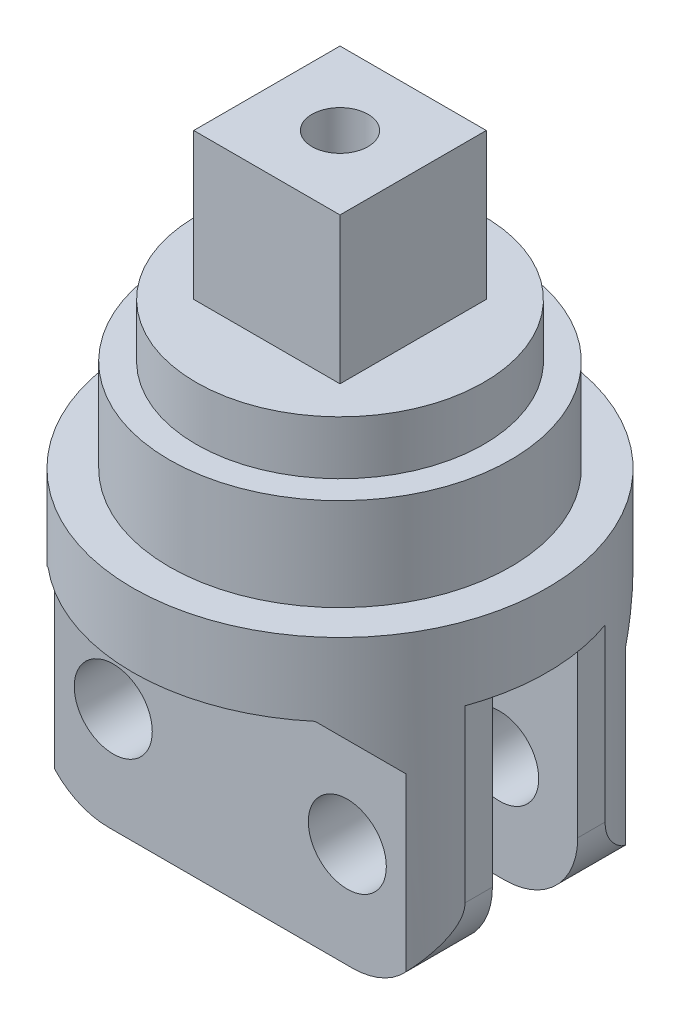
from build123d import *
from build123d.topology import SkipClean

# Parameters (mm, degrees)
SKETCH_9_R          = 9
EXTRUDE_4_DEPTH     = 3
SKETCH_10_R         = 7
EXTRUDE_5_DEPTH     = 6
SKETCH_11_W         = 16
SKETCH_11_H         = 3
EXTRUDE_6_DEPTH     = 10
SKETCH_12_R         = 1.6
CUT_EXTRUDE_3_DEPTH = 20.059118553
SKETCH_13_R         = 12.035495365
SKETCH_13_R_2       = 9
CUT_EXTRUDE_4_DEPTH = 30
FILLET_1_R          = 3
SKETCH_14_R         = 1.15
CUT_EXTRUDE_5_DEPTH = 30
SKETCH_15_W         = 22.433214128
SKETCH_15_H         = 3.5
CUT_EXTRUDE_6_DEPTH = 20
SKETCH_17_R         = 12.049205959
SKETCH_17_R_2       = 8.5
CUT_EXTRUDE_7_DEPTH = 20
SKETCH_18_R         = 9.534410067
SKETCH_18_R_2       = 5.9
CUT_EXTRUDE_8_DEPTH = 2.2
SKETCH_20_W         = 6
SKETCH_20_H         = 6
SKETCH_20_R         = 1.15
EXTRUDE_7_DEPTH     = 6
CHAMFER_1_SIZE      = 2


with BuildPart() as part:
    # Эскиз9 → Бобышка-Вытянуть4 (new body)
    with BuildSketch(Plane(origin=(0, 0, 0), x_dir=(1, 0, 0), z_dir=(0, 1, 0))):
        with Locations(Location((0, 0, 0), (0, 0, 270))):
            Circle(SKETCH_9_R)
    extrude(amount=EXTRUDE_4_DEPTH)

    # Эскиз10 → Бобышка-Вытянуть5 (add)
    with BuildSketch(Plane(origin=(0, 3, 0), x_dir=(1, 0, 0), z_dir=(0, 1, 0))):
        with Locations(Location((0, 0, 0), (0, 0, 270))):
            Circle(SKETCH_10_R)
    extrude(amount=EXTRUDE_5_DEPTH)

    # Эскиз11 → Бобышка-Вытянуть6 (add)
    with BuildSketch(Plane.XZ):
        with Locations((0, -3)):
            Rectangle(SKETCH_11_W, SKETCH_11_H)
        with Locations((0, 3)):
            Rectangle(SKETCH_11_W, SKETCH_11_H)
    extrude(amount=EXTRUDE_6_DEPTH)

    # Эскиз12 → Вырез-Вытянуть3 (cut, through all)
    with BuildSketch(Plane.XY.offset(4.5)):
        with Locations((-4.8, -5.7)):
            Circle(SKETCH_12_R)
        with Locations((4.8, -5.7)):
            Circle(SKETCH_12_R)
    extrude(amount=-CUT_EXTRUDE_3_DEPTH, mode=Mode.SUBTRACT)

    # Эскиз13 → Вырез-Вытянуть4 (cut)
    with SkipClean():  # the faces are left unmerged after this step: merging them gives an invalid solid
        with BuildSketch(Plane.XZ.offset(10)):
            Circle(SKETCH_13_R)
            with Locations(Location((0, 0, 0), (0, 0, 210))):
                Circle(SKETCH_13_R_2, mode=Mode.SUBTRACT)
        extrude(amount=-CUT_EXTRUDE_4_DEPTH, mode=Mode.SUBTRACT)
    add(part.part.scale(1), mode=Mode.REPLACE)  # the faces are merged on a copy

    # Скругление1
    fillet_1_edges = [part.edges().sort_by_distance(p)[0] for p in [
        (-8, -10, -2.811552813),
        (8, -10, -2.811552813),
        (8, -10, 2.811552813),
        (-8, -10, 2.811552813),
    ]]
    fillet(fillet_1_edges, radius=FILLET_1_R)

    # Эскиз14 → Вырез-Вытянуть5 (cut)
    with BuildSketch(Plane.XZ):
        with Locations(Location((0, 0, 0), (0, 0, 270))):
            Circle(SKETCH_14_R)
    extrude(amount=-CUT_EXTRUDE_5_DEPTH, mode=Mode.SUBTRACT)

    # Эскиз15 → Вырез-Вытянуть6 (cut)
    with BuildSketch(Plane.XZ):
        Rectangle(SKETCH_15_W, SKETCH_15_H)
    extrude(amount=CUT_EXTRUDE_6_DEPTH, mode=Mode.SUBTRACT)

    # Эскиз17 → Вырез-Вытянуть7 (cut)
    with BuildSketch(Plane.XZ.offset(10)):
        Circle(SKETCH_17_R)
        with Locations(Location((0, 0, 0), (0, 0, 328.034281249))):
            Circle(SKETCH_17_R_2, mode=Mode.SUBTRACT)
    extrude(amount=-CUT_EXTRUDE_7_DEPTH, mode=Mode.SUBTRACT)

    # Эскиз18 → Вырез-Вытянуть8 (cut)
    with BuildSketch(Plane(origin=(0, 9, 0), x_dir=(1, 0, 0), z_dir=(0, 1, 0))):
        Circle(SKETCH_18_R)
        with Locations(Location((0, 0, 0), (0, 0, 270))):
            Circle(SKETCH_18_R_2, mode=Mode.SUBTRACT)
    extrude(amount=-CUT_EXTRUDE_8_DEPTH, mode=Mode.SUBTRACT)

    # Эскиз20 → Бобышка-Вытянуть7 (add)
    with SkipClean():  # the faces are left unmerged after this step: merging them gives an invalid solid
        with BuildSketch(Plane(origin=(0, 9, 0), x_dir=(1, 0, 0), z_dir=(0, 1, 0))):
            Rectangle(SKETCH_20_W, SKETCH_20_H)
            with Locations(Location((0, 0, 0), (0, 0, 90))):
                Circle(SKETCH_20_R, mode=Mode.SUBTRACT)
        extrude(amount=EXTRUDE_7_DEPTH)

    # Фаска1
    # the kernel refuses this chamfer: 2 mm, written as the material it adds along each edge
    with BuildSketch(Plane(origin=(12.354468527, 0, -4.5), x_dir=(0, -0.9996219169112968, 0.027495876610586494), z_dir=(-1, 0, 0))) as chamfer_1_piece_1_section:
        Polygon((CHAMFER_1_SIZE * 0.999621916911, -CHAMFER_1_SIZE * 0.0274958766106), (-CHAMFER_1_SIZE * 0.0274958766106, -CHAMFER_1_SIZE * 0.999621916911), (0, 0), align=None)
    chamfer_1_piece_1 = extrude(amount=24.708937054, mode=Mode.PRIVATE)
    chamfer_1_piece_1 = chamfer_1_piece_1 & Plane(origin=(0, -0.675834344, 0), x_dir=(0.8483650059896506, 0, -0.5294117647088891), z_dir=(0, -1, 0)) * Cylinder(8.5, 58, mode=Mode.PRIVATE)
    add(chamfer_1_piece_1)
    with BuildSketch(Plane(origin=(-12.354468527, 0, 4.5), x_dir=(0, -0.9996219169112968, -0.027495876610586494), z_dir=(1, 0, 0))) as chamfer_1_piece_2_section:
        Polygon((CHAMFER_1_SIZE * 0.999621916911, -CHAMFER_1_SIZE * 0.0274958766106), (-CHAMFER_1_SIZE * 0.0274958766106, -CHAMFER_1_SIZE * 0.999621916911), (0, 0), align=None)
    chamfer_1_piece_2 = extrude(amount=24.708937054, mode=Mode.PRIVATE)
    chamfer_1_piece_2 = chamfer_1_piece_2 & Plane(origin=(0, -0.675834348, 0), x_dir=(0.8483650059896506, 0, -0.5294117647088891), z_dir=(0, -1, 0)) * Cylinder(8.5, 58, mode=Mode.PRIVATE)
    add(chamfer_1_piece_2)


solid = part.part
